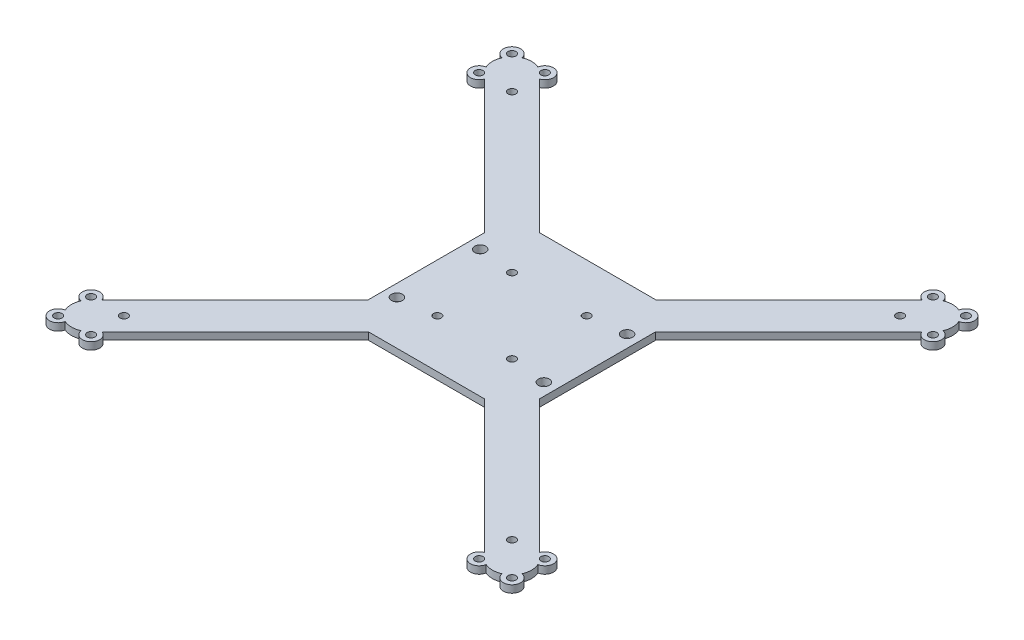
from build123d import *

# Parameters (mm, degrees)
SKETCH1_R           = 1.6
SKETCH1_R_2         = 2.25
BOSS_EXTRUDE1_DEPTH = 3


with BuildPart() as part:
    # Sketch1 → Boss-Extrude1 (new body)
    with BuildSketch(Plane(origin=(0, 0, 0), x_dir=(1, 0, 0), z_dir=(0, 1, 0))):
        with BuildLine():
            Line((-78.067755892, -89.381464391), (-23.686291501, -35))
            Line((-23.686291501, -35), (23.686291501, -35))
            Line((23.686291501, -35), (78.067755892, -89.381464391))
            ThreePointArc((78.067755892, -89.381464391), (76.99339786, -95.359340368), (82.693910545, -93.263296116))
            ThreePointArc((82.693910545, -93.263296116), (85.960678119, -93.960678119), (89.227445693, -93.263296116))
            ThreePointArc((89.227445693, -93.263296116), (95.153066274, -95.153066274), (93.263296116, -89.227445693))
            ThreePointArc((93.263296116, -89.227445693), (93.960678119, -85.960678119), (93.263296116, -82.693910545))
            ThreePointArc((93.263296116, -82.693910545), (95.359340368, -76.99339786), (89.381464391, -78.067755892))
            Line((89.381464391, -78.067755892), (35, -23.686291501))
            Line((35, -23.686291501), (35, 23.686291501))
            Line((35, 23.686291501), (89.381464391, 78.067755892))
            ThreePointArc((89.381464391, 78.067755892), (95.153066274, 76.768289963), (93.853600346, 82.539891847))
            ThreePointArc((93.853600346, 82.539891847), (93.561810399, 82.629787308), (93.263296116, 82.693910545))
            ThreePointArc((93.263296116, 82.693910545), (93.960678119, 85.960678119), (93.263296116, 89.227445693))
            ThreePointArc((93.263296116, 89.227445693), (95.153066274, 95.153066274), (89.227445693, 93.263296116))
            ThreePointArc((89.227445693, 93.263296116), (85.960678119, 93.960678119), (82.693910545, 93.263296116))
            ThreePointArc((82.693910545, 93.263296116), (82.629787308, 93.561810399), (82.539891847, 93.853600346))
            ThreePointArc((82.539891847, 93.853600346), (76.768289963, 95.153066274), (78.067755892, 89.381464391))
            Line((78.067755892, 89.381464391), (23.686291501, 35))
            Line((23.686291501, 35), (-23.686291501, 35))
            Line((-23.686291501, 35), (-78.067755892, 89.381464391))
            ThreePointArc((-78.067755892, 89.381464391), (-76.99339786, 95.359340368), (-82.693910545, 93.263296116))
            ThreePointArc((-82.693910545, 93.263296116), (-85.960678119, 93.960678119), (-89.227445693, 93.263296116))
            ThreePointArc((-89.227445693, 93.263296116), (-95.153066274, 95.153066274), (-93.263296116, 89.227445693))
            ThreePointArc((-93.263296116, 89.227445693), (-93.960678119, 85.960678119), (-93.263296116, 82.693910545))
            ThreePointArc((-93.263296116, 82.693910545), (-95.359340368, 76.99339786), (-89.381464391, 78.067755892))
            Line((-89.381464391, 78.067755892), (-35, 23.686291501))
            Line((-35, 23.686291501), (-35, -23.686291501))
            Line((-35, -23.686291501), (-89.381464391, -78.067755892))
            ThreePointArc((-89.381464391, -78.067755892), (-95.359340368, -76.99339786), (-93.263296116, -82.693910545))
            ThreePointArc((-93.263296116, -82.693910545), (-93.960678119, -85.960678119), (-93.263296116, -89.227445693))
            ThreePointArc((-93.263296116, -89.227445693), (-95.153066274, -95.153066274), (-89.227445693, -93.263296116))
            ThreePointArc((-89.227445693, -93.263296116), (-85.960678119, -93.960678119), (-82.693910545, -93.263296116))
            ThreePointArc((-82.693910545, -93.263296116), (-76.99339786, -95.359340368), (-78.067755892, -89.381464391))
        make_face()
        with Locations((-92.67819254, -92.67819254)):
            Circle(SKETCH1_R, mode=Mode.SUBTRACT)
        with Locations((-79.243163697, -92.67819254)):
            Circle(SKETCH1_R, mode=Mode.SUBTRACT)
        with Locations((-92.67819254, -79.243163697)):
            Circle(SKETCH1_R, mode=Mode.SUBTRACT)
        with Locations((-79.243163697, -79.243163697)):
            Circle(SKETCH1_R, mode=Mode.SUBTRACT)
        with Locations((-30, -17)):
            Circle(SKETCH1_R_2, mode=Mode.SUBTRACT)
        with Locations((-15.25, -15.25)):
            Circle(SKETCH1_R, mode=Mode.SUBTRACT)
        with Locations((79.243163697, -92.67819254)):
            Circle(SKETCH1_R, mode=Mode.SUBTRACT)
        with Locations((92.67819254, -92.67819254)):
            Circle(SKETCH1_R, mode=Mode.SUBTRACT)
        with Locations((79.243163697, -79.243163697)):
            Circle(SKETCH1_R, mode=Mode.SUBTRACT)
        with Locations((92.67819254, -79.243163697)):
            Circle(SKETCH1_R, mode=Mode.SUBTRACT)
        with Locations((15.25, -15.25)):
            Circle(SKETCH1_R, mode=Mode.SUBTRACT)
        with Locations((30, -17)):
            Circle(SKETCH1_R_2, mode=Mode.SUBTRACT)
        with Locations((-30, 17)):
            Circle(SKETCH1_R_2, mode=Mode.SUBTRACT)
        with Locations((-15.25, 15.25)):
            Circle(SKETCH1_R, mode=Mode.SUBTRACT)
        with Locations((-92.67819254, 79.243163697)):
            Circle(SKETCH1_R, mode=Mode.SUBTRACT)
        with Locations((-79.243163697, 79.243163697)):
            Circle(SKETCH1_R, mode=Mode.SUBTRACT)
        with Locations((-92.67819254, 92.67819254)):
            Circle(SKETCH1_R, mode=Mode.SUBTRACT)
        with Locations((-79.243163697, 92.67819254)):
            Circle(SKETCH1_R, mode=Mode.SUBTRACT)
        with Locations((15.25, 15.25)):
            Circle(SKETCH1_R, mode=Mode.SUBTRACT)
        with Locations((30, 17)):
            Circle(SKETCH1_R_2, mode=Mode.SUBTRACT)
        with Locations((79.243163697, 79.243163697)):
            Circle(SKETCH1_R, mode=Mode.SUBTRACT)
        with Locations((92.67819254, 79.243163697)):
            Circle(SKETCH1_R, mode=Mode.SUBTRACT)
        with Locations((79.243163697, 92.67819254)):
            Circle(SKETCH1_R, mode=Mode.SUBTRACT)
        with Locations((92.67819254, 92.67819254)):
            Circle(SKETCH1_R, mode=Mode.SUBTRACT)
    extrude(amount=BOSS_EXTRUDE1_DEPTH)


solid = part.part
